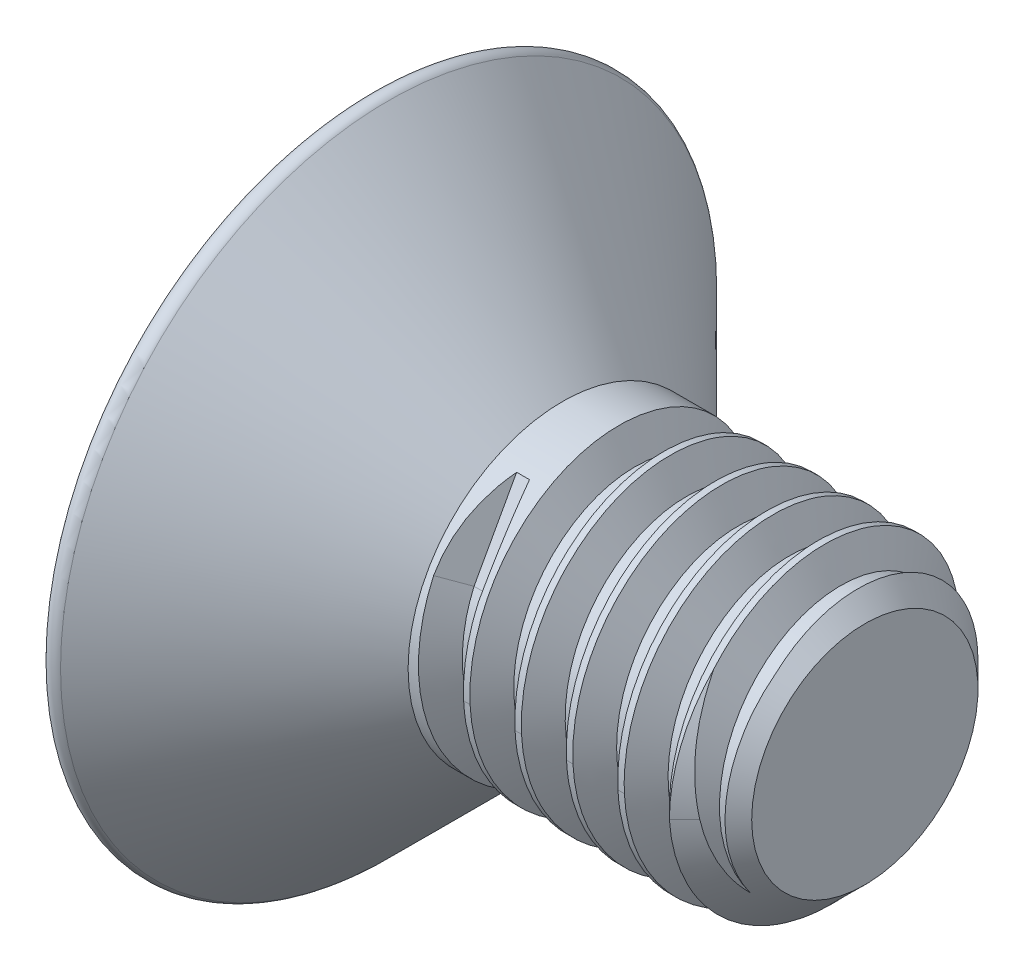
from build123d import *

# Parameters (mm, degrees)
CHAMFER1_SIZE      = 0.8
THREAD1_PITCH      = 1
CUT_EXTRUDE1_DEPTH = 10
FILLET1_R          = 0.2
CUT_EXTRUDE2_DEPTH = 2.3
CUT_EXTRUDE2_DRAFT = -3
FILLET2_R          = 0.2


with BuildPart() as part:
    # Sketch2 → Revolve1 (revolve)
    with BuildSketch(Plane.XY, mode=Mode.PRIVATE) as revolve1_sk:
        Polygon((0, 0), (0, 6.72), (3.72, 3), (9.6, 3), (9.6, 0), align=None)
    revolve(revolve1_sk.sketch.rotate(Axis((0, 0, 0), (1, 0, 0)), 90), axis=Axis((0, 0, 0), (1, 0, 0)))

    # Chamfer1
    chamfer1_edges = [part.edges().sort_by_distance(p)[0] for p in [
        (9.6, 0, -3),
    ]]
    chamfer(chamfer1_edges, length=CHAMFER1_SIZE)

    # Thread1: the profile of Thread Profile1 profile screwed along a right-hand helix of 7.08 turns, 8 arcs to a turn; built about Z, then put on its axis
    thread1_z = Axis((0, 0, 0), (0, 0, 1))
    thread1_corners = [(3.0003, 0, -0.000173205), (3.0003, 0, 0.875173202), (2.458734125, 0, 0.562499999), (2.458734125, 0, 0.312499999)]
    with BuildLine(mode=Mode.PRIVATE) as thread1_profile:
        Line(thread1_corners[0], thread1_corners[1])
        Line(thread1_corners[1], thread1_corners[2])
        Line(thread1_corners[2], thread1_corners[3])
        Line(thread1_corners[3], thread1_corners[0])
    thread1_cap = Face(thread1_profile.wire())
    thread1_turn_angles = [0, 22.5, 45, 67.5, 90, 112.5, 135, 157.5, 180, 202.5, 225, 247.5, 270, 292.5, 315, 337.5, 360]
    thread1_turn_weights = [1, 0.9238795325112867, 1, 0.9238795325112867, 1, 0.9238795325112867, 1, 0.9238795325112867, 1, 0.9238795325112867, 1, 0.9238795325112867, 1, 0.9238795325112867, 1, 0.9238795325112867, 1]
    thread1_turn_rails = [Edge.make_bspline([Vector(p[0], p[1], 0).rotate(thread1_z, thread1_turn_angles[k]) / thread1_turn_weights[k] + Vector(0, 0, p[2] + THREAD1_PITCH * thread1_turn_angles[k] / 360) for k in range(17)], [0, 0, 0, 1, 1, 2, 2, 3, 3, 4, 4, 5, 5, 6, 6, 7, 7, 8, 8, 8], 2, thread1_turn_weights) for p in thread1_corners]
    thread1_turn_sides = [Face.make_surface_from_curves(thread1_turn_rails[p[0]], thread1_turn_rails[p[1]]) for p in [(0, 1), (1, 2), (2, 3), (3, 0)]]
    thread1_last_angles = [2520, 2534.4, 2548.8]
    thread1_last_weights = [1, 0.9685831611286297, 1]
    thread1_last_rails = [Edge.make_bspline([Vector(p[0], p[1], 0).rotate(thread1_z, thread1_last_angles[k]) / thread1_last_weights[k] + Vector(0, 0, p[2] + THREAD1_PITCH * thread1_last_angles[k] / 360) for k in range(3)], [0, 0, 0, 1, 1, 1], 2, thread1_last_weights) for p in thread1_corners]
    thread1_last_sides = [Face.make_surface_from_curves(thread1_last_rails[p[0]], thread1_last_rails[p[1]]) for p in [(0, 1), (1, 2), (2, 3), (3, 0)]]
    thread1 = Plane(origin=(11.8, 0, 0), x_dir=(0, 0, 1), z_dir=(-1, 0, 0)) * Solid(Shell([*[p.moved(Location((0, 0, THREAD1_PITCH * i))) for i in range(7) for p in thread1_turn_sides], *thread1_last_sides, thread1_cap, thread1_cap.rotate(thread1_z, 2548.8).moved(Location((0, 0, THREAD1_PITCH * 2548.8 / 360)))]))
    add(thread1, mode=Mode.SUBTRACT)

    # Sketch6 → Cut-Extrude1 (cut)
    with BuildSketch(Plane(origin=(0, 1.0541e-05, -5.795e-06), x_dir=(0.999999999895238, 3.1696954323216026e-06, 1.4123634026174722e-05), z_dir=(-4.026401894989451e-06, -0.876309639361958, 0.48174829106609524))):
        Polygon((4.407113025, 2.45867285), (4.719621237, 2.99993438), (3.844621097, 2.999946546), (4.1571128, 2.458676326), align=None)
    extrude(amount=-CUT_EXTRUDE1_DEPTH, mode=Mode.SUBTRACT)

    # Fillet1
    fillet1_edges = [part.edges().sort_by_distance(p)[0] for p in [
        (0, 0, -6.72),
    ]]
    fillet(fillet1_edges, radius=FILLET1_R)


with BuildPart() as cut_extrude2_tool:
    # Sketch7 → Cut-Extrude2 (with draft: the straight prism first)
    with BuildSketch(Plane.ZY):
        Polygon((0, 2.364249352), (-2.0475, 1.182124676), (-2.0475, -1.182124676), (0, -2.364249352), (2.0475, -1.182124676), (2.0475, 1.182124676), align=None)
    extrude(amount=-CUT_EXTRUDE2_DEPTH)
    # Cut-Extrude2: the draft: its side faces are tilted about the plane it starts from
    cut_extrude2_sides = [cut_extrude2_tool.faces().sort_by_distance(p)[0] for p in [
        (1.15, 1.773187014, -1.02375),
        (1.15, 0, -2.0475),
        (1.15, -1.773187014, -1.02375),
        (1.15, -1.773187014, 1.02375),
        (1.15, 0, 2.0475),
        (1.15, 1.773187014, 1.02375),
    ]]
    draft(cut_extrude2_sides, Plane.ZY, CUT_EXTRUDE2_DRAFT)


with BuildPart() as part_1:
    add(part.part)

    # Cut-Extrude2: cut by cut_extrude2_tool
    add(cut_extrude2_tool.part, mode=Mode.SUBTRACT)

    # Fillet2
    fillet2_edges = [part_1.edges().sort_by_distance(p)[0] for p in [
        (0, 1.773187014, 1.02375),
        (0, 1.773187014, -1.02375),
        (0, 0, -2.0475),
        (0, -1.773187014, -1.02375),
        (0, -1.773187014, 1.02375),
        (0, 0, 2.0475),
    ]]
    fillet(fillet2_edges, radius=FILLET2_R)


solid = part_1.part
